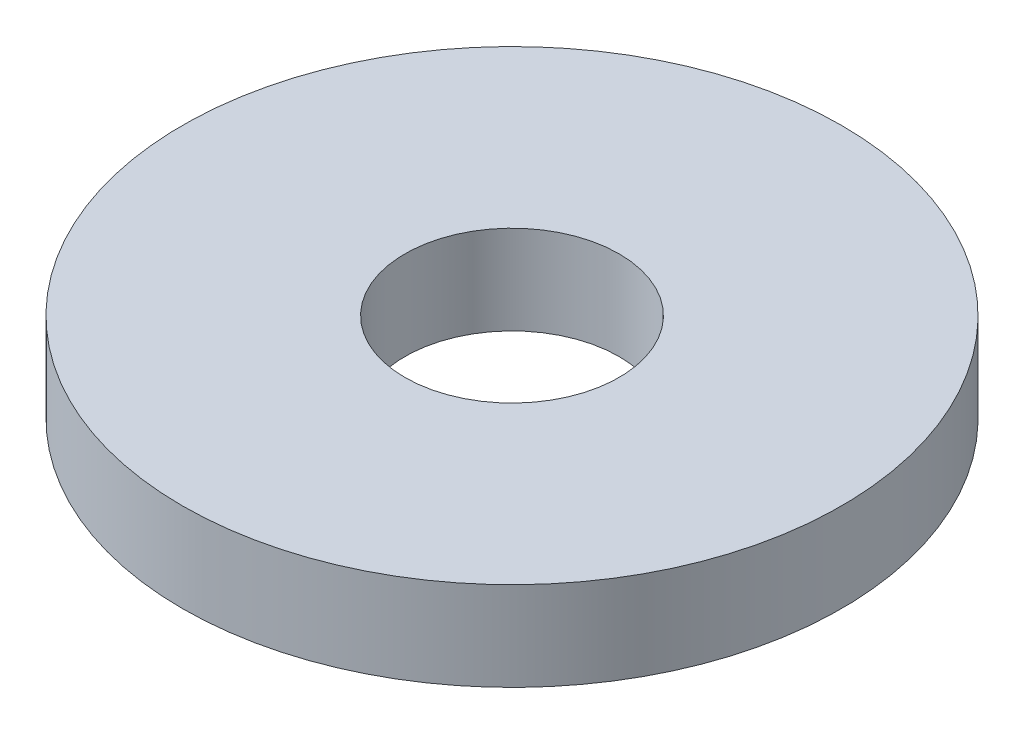
from build123d import *

# Parameters (mm, degrees)
SKETCH1_R           = 100
BOSS_EXTRUDE1_DEPTH = 27
SKETCH2_R           = 32.5
CUT_EXTRUDE1_DEPTH  = 144.975692393


with BuildPart() as part:
    # Sketch1 → Boss-Extrude1 (new body)
    with BuildSketch(Plane(origin=(0, 0, 0), x_dir=(1, 0, 0), z_dir=(0, 1, 0))):
        Circle(SKETCH1_R)
    extrude(amount=BOSS_EXTRUDE1_DEPTH)

    # Sketch2 → Cut-Extrude1 (cut, through all)
    with BuildSketch(Plane(origin=(0, 0, 0), x_dir=(1, 0, 0), z_dir=(0, 1, 0))):
        Circle(SKETCH2_R)
    extrude(amount=CUT_EXTRUDE1_DEPTH, mode=Mode.SUBTRACT)


solid = part.part
